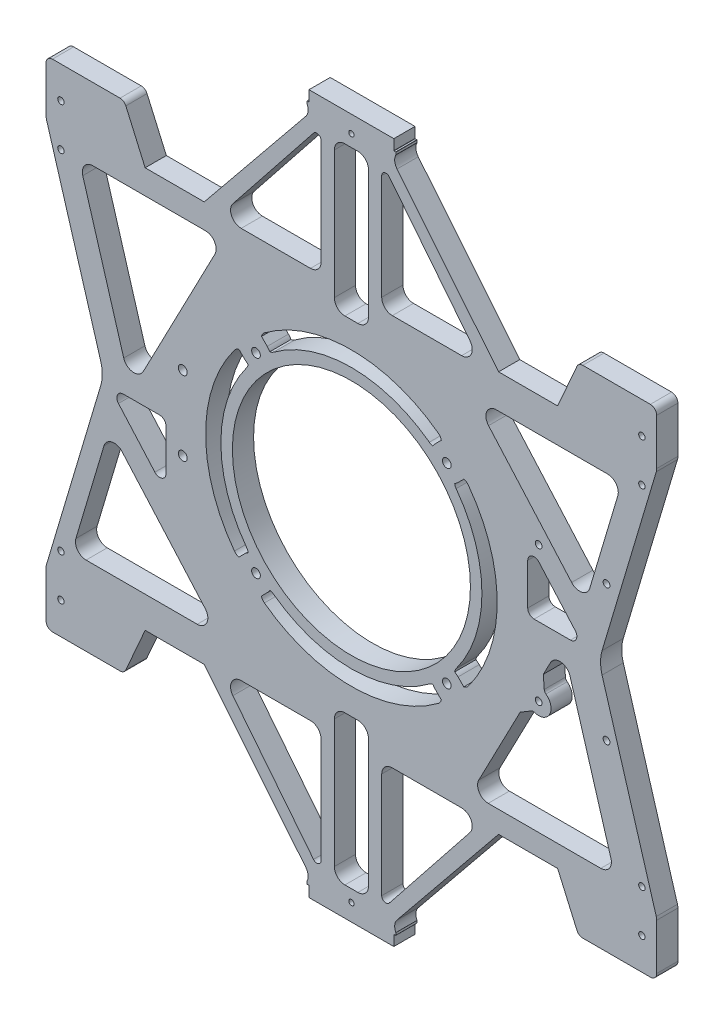
from build123d import *

# Parameters (mm, degrees)
SKETCH_1_R               = 85
SKETCH_1_R_2             = 75
SKETCH_1_R_3             = 7.5
SKETCH_1_R_4             = 2.05
EXTRUDE_1_DEPTH          = 5
EXTRUDE_2_DEPTH          = 5
EXTRUDE_6_DEPTH          = 10
FILLET_2_R               = 0.1
CUT_EXTRUDE_3_DEPTH      = 10
SKETCH_6_W               = 51.301962359
SKETCH_6_H               = 47.017163002
CUT_EXTRUDE_5_DEPTH      = 10
FILLET_3_R               = 3
SKETCH_7_R               = 1.5
CUT_EXTRUDE_6_DEPTH      = 10
MIRROR_2_COPY_1_SKETCH_R = 1.5
MIRROR_2_COPY_1_DEPTH    = 10
SKETCH_8_R               = 1.25
CUT_EXTRUDE_7_DEPTH      = 10
CUT_EXTRUDE_11_DEPTH     = 10
FILLET_6_R               = 5
FILLET_7_R               = 5
SKETCH_16_R              = 2.1
CUT_EXTRUDE_12_DEPTH     = 10
SKETCH_17_R              = 75
SKETCH_17_R_2            = 56.139610307
SKETCH_17_R_3            = 2.05
EXTRUDE_7_DEPTH          = 10
SKETCH_18_R              = 1.6
CUT_EXTRUDE_13_DEPTH     = 10
SKETCH_18_3_R            = 1.6
EXTRUDE_8_DEPTH          = 10
EXTRUDE_9_DEPTH          = 10
FILLET_8_R               = 2


with BuildPart() as part:
    # 草图1 → 凸台-拉伸1 (new, symmetric)
    # profile 1 of 9: a face of its own
    with BuildSketch(Plane.XY):
        Circle(SKETCH_1_R)
        Circle(SKETCH_1_R_2, mode=Mode.SUBTRACT)
    # profile 2 of 9: a face of its own
    with BuildSketch(Plane.XY):
        with BuildLine():
            ThreePointArc((-50.303300859, 39.696699141), (-50.303300859, 50.303300859), (-39.696699141, 50.303300859))
            Line((-39.696699141, 50.303300859), (-47.463876439, 58.070478157))
            ThreePointArc((-47.463876439, 58.070478157), (-53.033008589, 53.033008589), (-58.070478157, 47.463876439))
            Line((-58.070478157, 47.463876439), (-50.303300859, 39.696699141))
        make_face()
    # profile 3 of 9: a face of its own
    with BuildSketch(Plane.XY):
        with Locations((-45, 45)):
            Circle(SKETCH_1_R_3)
        with Locations((-45, 45)):
            Circle(SKETCH_1_R_4, mode=Mode.SUBTRACT)
    # profile 4 of 9: a face of its own
    with BuildSketch(Plane.XY):
        with BuildLine():
            ThreePointArc((58.070478157, 47.463876439), (53.033008589, 53.033008589), (47.463876439, 58.070478157))
            Line((47.463876439, 58.070478157), (39.696699141, 50.303300859))
            ThreePointArc((39.696699141, 50.303300859), (47.870125743, 51.929096494), (52.5, 45))
            ThreePointArc((52.5, 45), (51.929096494, 42.129874257), (50.303300859, 39.696699141))
            Line((50.303300859, 39.696699141), (58.070478157, 47.463876439))
        make_face()
    # profile 5 of 9: a face of its own
    with BuildSketch(Plane.XY):
        with Locations((45, 45)):
            Circle(SKETCH_1_R_3)
        with Locations((45, 45)):
            Circle(SKETCH_1_R_4, mode=Mode.SUBTRACT)
    # profile 6 of 9: a face of its own
    with BuildSketch(Plane.XY):
        with Locations((45, -45)):
            Circle(SKETCH_1_R_3)
        with Locations((45, -45)):
            Circle(SKETCH_1_R_4, mode=Mode.SUBTRACT)
    # profile 7 of 9: a face of its own
    with BuildSketch(Plane.XY):
        with BuildLine():
            ThreePointArc((47.463876439, -58.070478157), (53.033008589, -53.033008589), (58.070478157, -47.463876439))
            Line((58.070478157, -47.463876439), (50.303300859, -39.696699141))
            ThreePointArc((50.303300859, -39.696699141), (51.929096494, -42.129874257), (52.5, -45))
            ThreePointArc((52.5, -45), (47.870125743, -51.929096494), (39.696699141, -50.303300859))
            Line((39.696699141, -50.303300859), (47.463876439, -58.070478157))
        make_face()
    # profile 8 of 9: a face of its own
    with BuildSketch(Plane.XY):
        with Locations((-45, -45)):
            Circle(SKETCH_1_R_3)
        with Locations((-45, -45)):
            Circle(SKETCH_1_R_4, mode=Mode.SUBTRACT)
    # profile 9 of 9: a face of its own
    with BuildSketch(Plane.XY):
        with BuildLine():
            Line((-50.303300859, -39.696699141), (-58.070478157, -47.463876439))
            ThreePointArc((-58.070478157, -47.463876439), (-53.033008589, -53.033008589), (-47.463876439, -58.070478157))
            Line((-47.463876439, -58.070478157), (-39.696699141, -50.303300859))
            ThreePointArc((-39.696699141, -50.303300859), (-50.303300859, -50.303300859), (-50.303300859, -39.696699141))
        make_face()
    extrude(amount=EXTRUDE_1_DEPTH, both=True)

    # 草图2 → 凸台-拉伸2 (add, symmetric)
    with BuildSketch(Plane.XY):
        with BuildLine():
            ThreePointArc((20.946126595, 158.836022137), (20.502012552, 158.586499594), (20, 158.5))
            Line((20, 158.5), (20, 82.613558209))
            ThreePointArc((20, 82.613558209), (66.801946079, 52.559490104), (85, 0))
            ThreePointArc((85, 0), (66.801946079, -52.559490104), (20, -82.613558209))
            Line((20, -82.613558209), (20, -158.5))
            ThreePointArc((20, -158.5), (20.502012552, -158.586499594), (20.946126595, -158.836022137))
            Line((20.946126595, -158.836022137), (72.374524243, -95.565930488))
            ThreePointArc((72.374524243, -95.565930488), (73.413441485, -94.749239274), (74.702479969, -94.458183678))
            Line((74.702479969, -94.458183678), (97.272761921, -94.458183678))
            Line((97.272761921, -94.458183678), (125.278494009, -158.206642183))
            ThreePointArc((125.278494009, -158.206642183), (126.384997835, -159.511964027), (128.025130978, -160))
            Line((128.025130978, -160), (144, -160))
            Line((144, -160), (144, -92.25001583))
            ThreePointArc((144, -92.25001583), (143.947696497, -91.528698023), (143.791880249, -90.822471196))
            Line((143.791880249, -90.822471196), (118.223516251, -4.996406216))
            ThreePointArc((118.223516251, -4.996406216), (117.495097123, 0), (118.223516251, 4.996406216))
            Line((118.223516251, 4.996406216), (143.791880249, 90.822471196))
            ThreePointArc((143.791880249, 90.822471196), (143.947696497, 91.528698023), (144, 92.25001583))
            Line((144, 92.25001583), (144, 160))
            Line((144, 160), (128.025130978, 160))
            ThreePointArc((128.025130978, 160), (126.384997835, 159.511964027), (125.278494009, 158.206642183))
            Line((125.278494009, 158.206642183), (97.272761921, 94.458183678))
            Line((97.272761921, 94.458183678), (74.702479969, 94.458183678))
            ThreePointArc((74.702479969, 94.458183678), (73.413441485, 94.749239274), (72.374524243, 95.565930488))
            Line((72.374524243, 95.565930488), (20.946126595, 158.836022137))
        make_face()
        with BuildLine():
            ThreePointArc((-20, 158.5), (-20.502012552, 158.586499594), (-20.946126595, 158.836022137))
            Line((-20.946126595, 158.836022137), (-72.374524243, 95.565930488))
            ThreePointArc((-72.374524243, 95.565930488), (-73.413441485, 94.749239274), (-74.702479969, 94.458183678))
            Line((-74.702479969, 94.458183678), (-97.272761921, 94.458183678))
            Line((-97.272761921, 94.458183678), (-125.278494009, 158.206642183))
            ThreePointArc((-125.278494009, 158.206642183), (-126.384997835, 159.511964027), (-128.025130978, 160))
            Line((-128.025130978, 160), (-144, 160))
            Line((-144, 160), (-144, 92.25001583))
            ThreePointArc((-144, 92.25001583), (-143.947696497, 91.528698023), (-143.791880249, 90.822471196))
            Line((-143.791880249, 90.822471196), (-118.223516251, 4.996406216))
            ThreePointArc((-118.223516251, 4.996406216), (-117.495097123, 0), (-118.223516251, -4.996406216))
            Line((-118.223516251, -4.996406216), (-143.791880249, -90.822471196))
            ThreePointArc((-143.791880249, -90.822471196), (-143.947696497, -91.528698023), (-144, -92.25001583))
            Line((-144, -92.25001583), (-144, -160))
            Line((-144, -160), (-128.025130978, -160))
            ThreePointArc((-128.025130978, -160), (-126.384997835, -159.511964027), (-125.278494009, -158.206642183))
            Line((-125.278494009, -158.206642183), (-97.272761921, -94.458183678))
            Line((-97.272761921, -94.458183678), (-74.702479969, -94.458183678))
            ThreePointArc((-74.702479969, -94.458183678), (-73.413441485, -94.749239274), (-72.374524243, -95.565930488))
            Line((-72.374524243, -95.565930488), (-20.946126595, -158.836022137))
            ThreePointArc((-20.946126595, -158.836022137), (-20.502012552, -158.586499594), (-20, -158.5))
            Line((-20, -158.5), (-20, -82.613558209))
            ThreePointArc((-20, -82.613558209), (-85, 0), (-20, 82.613558209))
            Line((-20, 82.613558209), (-20, 158.5))
        make_face()
        with BuildLine():
            Line((20, 161.5), (20, 165))
            Line((20, 165), (-20, 165))
            Line((-20, 165), (-20, 161.5))
            ThreePointArc((-20, 161.5), (-18.939339828, 161.060660172), (-18.5, 160))
            ThreePointArc((-18.5, 160), (-18.939339828, 158.939339828), (-20, 158.5))
            Line((-20, 158.5), (-20, 82.613558209))
            ThreePointArc((-20, 82.613558209), (0, 85), (20, 82.613558209))
            Line((20, 82.613558209), (20, 158.5))
            ThreePointArc((20, 158.5), (18.5, 160), (20, 161.5))
        make_face()
        with BuildLine():
            Line((20, -158.5), (20, -82.613558209))
            ThreePointArc((20, -82.613558209), (0, -85), (-20, -82.613558209))
            Line((-20, -82.613558209), (-20, -158.5))
            ThreePointArc((-20, -158.5), (-18.939339828, -158.939339828), (-18.5, -160))
            ThreePointArc((-18.5, -160), (-18.939339828, -161.060660172), (-20, -161.5))
            Line((-20, -161.5), (-20, -165))
            Line((-20, -165), (20, -165))
            Line((20, -165), (20, -161.5))
            ThreePointArc((20, -161.5), (18.5, -160), (20, -158.5))
        make_face()
    extrude(amount=EXTRUDE_2_DEPTH, both=True)

    # 草图4 → 凸台-拉伸6 (add)
    with BuildSketch(Plane(origin=(0, 0, -5), x_dir=(-1, 0, 0), z_dir=(0, 0, -1))):
        Polygon((0, 165), (-20, 165), (-20, 160), (-20.946126595, 160), (-20.946126595, 158.836022137), (0, 158.836022137), align=None)
        Polygon((20, 165), (0, 165), (0, 158.836022137), (20.946126595, 158.836022137), (20.946126595, 160), (20, 160), align=None)
        Polygon((0, 157.92755691), (0, 158.836022137), (-20.946126595, 158.836022137), (-20.162822672, 157.92755691), align=None)
        Polygon((20.946126595, 158.836022137), (0, 158.836022137), (0, 157.92755691), (20.162822672, 157.92755691), align=None)
        Polygon((-20.946126595, -158.836022137), (-20.162822672, -157.92755691), (20.162822672, -157.92755691), (20.946126595, -158.836022137), align=None)
        Polygon((-20, -165), (-20, -160), (-20.946126595, -160), (-20.946126595, -158.836022137), (20.946126595, -158.836022137), (20.946126595, -160), (20, -160), (20, -165), align=None)
    extrude(amount=-EXTRUDE_6_DEPTH)

    # 圆角2
    fillet_2_edges = [part.edges().sort_by_distance(p)[0] for p in [
        (20.946126595, 160, 0),
        (20, 160, 0),
        (-20, 160, 0),
        (-20.946126595, 160, 0),
        (-20.946126595, -160, 0),
        (-20, -160, 0),
        (20, -160, 0),
        (20.946126595, -160, 0),
        (144, -160, 0),
        (144, 160, 0),
        (20.946126595, 158.836022137, 0),
        (-20.946126595, 158.836022137, 0),
        (-144, 160, 0),
        (-144, -160, 0),
        (-20.946126595, -158.836022137, 0),
        (20.946126595, -158.836022137, 0),
    ]]
    fillet(fillet_2_edges, radius=FILLET_2_R)

    # 草图5 → 切除-拉伸3 (cut)
    with BuildSketch(Plane(origin=(0, 0, -5), x_dir=(-1, 0, 0), z_dir=(0, 0, -1))):
        with BuildLine():
            Line((-17.862789417, 148.320403404), (-55.905502661, 100.478809476))
            ThreePointArc((-55.905502661, 100.478809476), (-56.495296771, 95.194269743), (-51.991975369, 92.366848015))
            Line((-51.991975369, 92.366848015), (-19.297378501, 92.366848015))
            ThreePointArc((-19.297378501, 92.366848015), (-15.761844595, 93.831314109), (-14.297378501, 97.366848015))
            Line((-14.297378501, 97.366848015), (-14.297378501, 147.075618819))
            ThreePointArc((-14.297378501, 147.075618819), (-15.638144791, 148.963848391), (-17.862789417, 148.320403404))
        make_face()
        with BuildLine():
            Line((-3.055863592, 151.352836998), (3.055863592, 151.352836998))
            ThreePointArc((3.055863592, 151.352836998), (6.591397498, 149.888370904), (8.055863592, 146.352836998))
            Line((8.055863592, 146.352836998), (8.055863592, 86.048360151))
            ThreePointArc((8.055863592, 86.048360151), (6.591397498, 82.512826245), (3.055863592, 81.048360151))
            Line((3.055863592, 81.048360151), (-3.055863592, 81.048360151))
            ThreePointArc((-3.055863592, 81.048360151), (-6.591397498, 82.512826245), (-8.055863592, 86.048360151))
            Line((-8.055863592, 86.048360151), (-8.055863592, 146.352836998))
            ThreePointArc((-8.055863592, 146.352836998), (-6.591397498, 149.888370904), (-3.055863592, 151.352836998))
        make_face()
        with BuildLine():
            Line((17.862789417, 148.320403404), (55.905502661, 100.478809476))
            ThreePointArc((55.905502661, 100.478809476), (56.495296771, 95.194269743), (51.991975369, 92.366848015))
            Line((51.991975369, 92.366848015), (19.297378501, 92.366848015))
            ThreePointArc((19.297378501, 92.366848015), (15.761844595, 93.831314109), (14.297378501, 97.366848015))
            Line((14.297378501, 97.366848015), (14.297378501, 147.075618819))
            ThreePointArc((14.297378501, 147.075618819), (15.638144791, 148.963848391), (17.862789417, 148.320403404))
        make_face()
        with BuildLine():
            Line((-88.411964724, 26.304592471), (-105.58420797, 6.825549304))
            ThreePointArc((-105.58420797, 6.825549304), (-106.068021221, 3.60709215), (-103.33382643, 1.841668531))
            Line((-103.33382643, 1.841668531), (-86.161583184, 1.841668531))
            ThreePointArc((-86.161583184, 1.841668531), (-84.04026284, 2.720348187), (-83.161583184, 4.841668531))
            Line((-83.161583184, 4.841668531), (-83.161583184, 24.320711698))
            ThreePointArc((-83.161583184, 24.320711698), (-85.101192836, 27.127056707), (-88.411964724, 26.304592471))
        make_face()
        with BuildLine():
            Line((125.148737545, -79.703150581), (72.714799918, -79.703150581))
            ThreePointArc((72.714799918, -79.703150581), (68.157808598, -76.760777882), (68.964164017, -71.396682626))
            Line((68.964164017, -71.396682626), (108.154563697, -26.941716773))
            ThreePointArc((108.154563697, -26.941716773), (112.979273925, -25.364910792), (116.697079847, -28.820640095))
            Line((116.697079847, -28.820640095), (129.940617794, -73.275605947))
            ThreePointArc((129.940617794, -73.275605947), (129.157336001, -77.691651612), (125.148737545, -79.703150581))
        make_face()
        with BuildLine():
            Line((92.688824268, -27.57870776), (109.861067514, -8.099664592))
            ThreePointArc((109.861067514, -8.099664592), (110.344880765, -4.881207439), (107.610685973, -3.11578382))
            Line((107.610685973, -3.11578382), (90.438442727, -3.11578382))
            ThreePointArc((90.438442727, -3.11578382), (88.317122384, -3.994463476), (87.438442727, -6.11578382))
            Line((87.438442727, -6.11578382), (87.438442727, -25.594826987))
            ThreePointArc((87.438442727, -25.594826987), (89.37805238, -28.401171996), (92.688824268, -27.57870776))
        make_face()
        with BuildLine():
            Line((64.354570863, 75.652229573), (98.156817983, 10.809427785))
            ThreePointArc((98.156817983, 10.809427785), (103.067325793, 8.143494388), (107.382429225, 11.693166232))
            Line((107.382429225, 11.693166232), (126.699688605, 76.535968021))
            ThreePointArc((126.699688605, 76.535968021), (125.916406812, 80.952013686), (121.907808356, 82.963512654))
            Line((121.907808356, 82.963512654), (68.788301856, 82.963512654))
            ThreePointArc((68.788301856, 82.963512654), (64.512999797, 80.556154607), (64.354570863, 75.652229573))
        make_face()
        with BuildLine():
            Line((14.297378501, -147.075618819), (14.297378501, -97.366848015))
            ThreePointArc((14.297378501, -97.366848015), (15.761844595, -93.831314109), (19.297378501, -92.366848015))
            Line((19.297378501, -92.366848015), (51.991975369, -92.366848015))
            ThreePointArc((51.991975369, -92.366848015), (56.495296771, -95.194269743), (55.905502661, -100.478809476))
            Line((55.905502661, -100.478809476), (17.862789417, -148.320403404))
            ThreePointArc((17.862789417, -148.320403404), (15.638144791, -148.963848391), (14.297378501, -147.075618819))
        make_face()
        with BuildLine():
            Line((-3.055863592, -81.048360151), (3.055863592, -81.048360151))
            ThreePointArc((3.055863592, -81.048360151), (6.591397498, -82.512826245), (8.055863592, -86.048360151))
            Line((8.055863592, -86.048360151), (8.055863592, -146.352836998))
            ThreePointArc((8.055863592, -146.352836998), (6.591397498, -149.888370904), (3.055863592, -151.352836998))
            Line((3.055863592, -151.352836998), (-3.055863592, -151.352836998))
            ThreePointArc((-3.055863592, -151.352836998), (-6.591397498, -149.888370904), (-8.055863592, -146.352836998))
            Line((-8.055863592, -146.352836998), (-8.055863592, -86.048360151))
            ThreePointArc((-8.055863592, -86.048360151), (-6.591397498, -82.512826245), (-3.055863592, -81.048360151))
        make_face()
        with BuildLine():
            Line((-17.862789417, -148.320403404), (-55.905502661, -100.478809476))
            ThreePointArc((-55.905502661, -100.478809476), (-56.495296771, -95.194269743), (-51.991975369, -92.366848015))
            Line((-51.991975369, -92.366848015), (-19.297378501, -92.366848015))
            ThreePointArc((-19.297378501, -92.366848015), (-15.761844595, -93.831314109), (-14.297378501, -97.366848015))
            Line((-14.297378501, -97.366848015), (-14.297378501, -147.075618819))
            ThreePointArc((-14.297378501, -147.075618819), (-15.638144791, -148.963848391), (-17.862789417, -148.320403404))
        make_face()
        with BuildLine():
            Line((-125.66375825, 72.001490659), (-112.420220303, 27.546524806))
            ThreePointArc((-112.420220303, 27.546524806), (-108.702414381, 24.090795503), (-103.877704153, 25.667601485))
            Line((-103.877704153, 25.667601485), (-64.687304473, 70.122567337))
            ThreePointArc((-64.687304473, 70.122567337), (-63.880949055, 75.486662593), (-68.437940375, 78.429035292))
            Line((-68.437940375, 78.429035292), (-120.871878001, 78.429035292))
            ThreePointArc((-120.871878001, 78.429035292), (-124.880476458, 76.417536323), (-125.66375825, 72.001490659))
        make_face()
        with BuildLine():
            Line((-103.105569682, -12.967281521), (-122.422829061, -77.81008331))
            ThreePointArc((-122.422829061, -77.81008331), (-121.639547269, -82.226128975), (-117.630948812, -84.237627943))
            Line((-117.630948812, -84.237627943), (-64.511442313, -84.237627943))
            ThreePointArc((-64.511442313, -84.237627943), (-60.236140253, -81.830269896), (-60.07771132, -76.926344862))
            Line((-60.07771132, -76.926344862), (-93.87995844, -12.083543073))
            ThreePointArc((-93.87995844, -12.083543073), (-98.79046625, -9.417609677), (-103.105569682, -12.967281521))
        make_face()
    extrude(amount=-CUT_EXTRUDE_3_DEPTH, mode=Mode.SUBTRACT)

    # 草图6 → 切除-拉伸5 (cut)
    with BuildSketch(Plane(origin=(0, 0, -5), x_dir=(-1, 0, 0), z_dir=(0, 0, -1))):
        with Locations((-118.34901882, 140.494508807)):
            Rectangle(SKETCH_6_W, SKETCH_6_H)
        Polygon((88.757366103, 116.985927306), (144, 116.985927306), (159.693978527, 195.891540768), (92.954798791, 181.200526361), align=None)
        Polygon((-111.178516053, -202.298889523), (-78.959246023, -116.985927306), (-144, -116.985927306), (-230.528890872, -157.225059538), align=None)
        Polygon((155.497903579, -186.437095046), (144, -116.985927306), (88.757366103, -116.985927306), (58.840093489, -186.437095046), align=None)
    extrude(amount=-CUT_EXTRUDE_5_DEPTH, mode=Mode.SUBTRACT)

    # 圆角3
    fillet_3_edges = [part.edges().sort_by_distance(p)[0] for p in [
        (107.169565191, -116.985927306, 0),
        (-107.169565191, -116.985927306, 0),
        (107.169565191, 116.985927306, 0),
        (-144, 116.985927306, 0),
        (-107.169565191, 116.985927306, 0),
        (144, -116.985927306, 0),
        (-144, -116.985927306, 0),
        (144, 116.985927306, 0),
    ]]
    fillet(fillet_3_edges, radius=FILLET_3_R)

    # 草图7 → 切除-拉伸6 (cut)
    with BuildSketch(Plane(origin=(0, 0, -5), x_dir=(-1, 0, 0), z_dir=(0, 0, -1))):
        with Locations((-137, 101.985927306)):
            Circle(SKETCH_7_R)
        with Locations((-137, 81.985927306)):
            Circle(SKETCH_7_R)
    cut_extrude_6 = extrude(amount=-CUT_EXTRUDE_6_DEPTH, mode=Mode.SUBTRACT)

    # 镜向1: 切除-拉伸6 across plane
    add(cut_extrude_6.mirror(Plane(origin=(0, 0, 0), x_dir=(0, 0, 1), z_dir=(1, 0, 0))), mode=Mode.SUBTRACT)

    # 镜向2: 切除-拉伸6 across plane
    add(cut_extrude_6.mirror(Plane.ZX), mode=Mode.SUBTRACT)

    # 镜向2 copy 1 sketch → 镜向2 copy 1 (cut)
    with BuildSketch(Plane(origin=(0, 0, -5), x_dir=(1, 0, 0), z_dir=(0, 0, -1))):
        with Locations((-137, 101.985927306)):
            Circle(MIRROR_2_COPY_1_SKETCH_R)
        with Locations((-137, 81.985927306)):
            Circle(MIRROR_2_COPY_1_SKETCH_R)
    extrude(amount=-MIRROR_2_COPY_1_DEPTH, mode=Mode.SUBTRACT)

    # 草图8 → 切除-拉伸7 (cut)
    with BuildSketch(Plane(origin=(0, 0, -5), x_dir=(-1, 0, 0), z_dir=(0, 0, -1))):
        with Locations((0, 157)):
            Circle(SKETCH_8_R)
    cut_extrude_7 = extrude(amount=-CUT_EXTRUDE_7_DEPTH, mode=Mode.SUBTRACT)

    # 镜向3: 切除-拉伸7 across plane
    add(cut_extrude_7.mirror(Plane.ZX), mode=Mode.SUBTRACT)

    # 草图14 → 切除-拉伸11 (cut)
    with BuildSketch(Plane(origin=(0, 0, -5), x_dir=(-1, 0, 0), z_dir=(0, 0, -1))):
        Polygon((-74.702479969, 94.458183678), (-69.40889114, 94.458183678), (-17.102475165, 158.808462588), (-20.968528071, 158.808462588), align=None)
        Polygon((74.702479969, 94.458183678), (69.40889114, 94.458183678), (17.102475165, 158.808462588), (20.968528071, 158.808462588), align=None)
        Polygon((74.702479969, -94.458183678), (20.968528071, -158.808462588), (17.102475165, -158.808462588), (69.40889114, -94.458183678), align=None)
        Polygon((-74.702479969, -94.458183678), (-69.40889114, -94.458183678), (-17.102475165, -158.808462588), (-20.968528071, -158.808462588), align=None)
    extrude(amount=-CUT_EXTRUDE_11_DEPTH, mode=Mode.SUBTRACT)

    # 圆角6
    # the kernel refuses this fillet: 5 mm, written as the material it adds along each edge
    with BuildSketch(Plane(origin=(-17.102475165, 158.808462588, -5), x_dir=(-0.6307510635211512, -0.7759852420419713, 0), z_dir=(0, 0, 1))) as fillet_6_piece_1:
        with BuildLine():
            CenterArc((7.021092677, -5), FILLET_6_R, 90, 66.421821522)
            Line((2.438516982, -3), (2.346865468, -2.96))
            ThreePointArc((2.346865468, -2.96), (1.141659967, -1.563075106), (-0.077598524, -0.063075106))
            Line((-0.077598524, -0.063075106), (0, 0.1))
            Line((0, 0.1), (7.021092677, 0.1))
            Line((7.021092677, 0.1), (7.021092677, 0))
        make_face()
    extrude(amount=10)
    with BuildSketch(Plane(origin=(17.102475165, 158.808462588, -5), x_dir=(1, 0, 0), z_dir=(0, 0, 1))) as fillet_6_piece_2:
        with BuildLine():
            CenterArc((8.308487883, -2.294508983), FILLET_6_R, 152.683734881, 66.421821522)
            Line((4.428561673, -5.4482643), (4.350963149, -5.511339407))
            Line((4.350963149, -5.511339407), (-0.077598524, -0.063075106))
            Line((-0.077598524, -0.063075106), (0, 0.1))
            ThreePointArc((0, 0.1), (1.933026453, 0.1), (3.777204206, 0.04589018))
            Line((3.777204206, 0.04589018), (3.866052906, 0))
        make_face()
    extrude(amount=10)

    # 圆角7
    # the kernel refuses this fillet: 5 mm, written as the material it adds along each edge
    with BuildSketch(Plane(origin=(-17.102475165, -158.808462588, -5), x_dir=(-0.630751063521152, 0.7759852420419706, 0), z_dir=(0, 0, 1))) as fillet_7_piece_1:
        with BuildLine():
            CenterArc((7.021092677, 5), FILLET_7_R, 203.578178478, 66.421821522)
            Line((2.438516982, 3), (2.346865468, 2.96))
            ThreePointArc((2.346865468, 2.96), (1.141659967, 1.563075106), (-0.077598524, 0.063075106))
            Line((-0.077598524, 0.063075106), (0, -0.1))
            Line((0, -0.1), (7.021092677, -0.1))
            Line((7.021092677, -0.1), (7.021092677, 0))
        make_face()
    extrude(amount=10)
    with BuildSketch(Plane(origin=(17.102475165, -158.808462588, -5), x_dir=(1, 0, 0), z_dir=(0, 0, 1))) as fillet_7_piece_2:
        with BuildLine():
            CenterArc((8.308487883, 2.294508983), FILLET_7_R, 140.894443597, 66.421821522)
            Line((4.428561673, 5.4482643), (4.350963149, 5.511339407))
            Line((4.350963149, 5.511339407), (-0.077598524, 0.063075106))
            Line((-0.077598524, 0.063075106), (0, -0.1))
            ThreePointArc((0, -0.1), (1.933026453, -0.1), (3.777204206, -0.04589018))
            Line((3.777204206, -0.04589018), (3.866052906, 0))
        make_face()
    extrude(amount=10)

    # 草图16 → 切除-拉伸12 (cut)
    with BuildSketch(Plane(origin=(0, 0, -5), x_dir=(-1, 0, 0), z_dir=(0, 0, -1))):
        with Locations((79.532362142, 20.695093854)):
            Circle(SKETCH_16_R)
        with Locations((79.532362142, -14.304906146)):
            Circle(SKETCH_16_R)
    extrude(amount=-CUT_EXTRUDE_12_DEPTH, mode=Mode.SUBTRACT)

    # 草图17 → 凸台-拉伸7 (add)
    with BuildSketch(Plane(origin=(0, 0, -5), x_dir=(-1, 0, 0), z_dir=(0, 0, -1))):
        Circle(SKETCH_17_R)
        Circle(SKETCH_17_R_2, mode=Mode.SUBTRACT)
        with Locations(Location((45, -45, 0), (0, 0, 180))):
            Circle(SKETCH_17_R_3, mode=Mode.SUBTRACT)
        with Locations(Location((-45, -45, 0), (0, 0, 180))):
            Circle(SKETCH_17_R_3, mode=Mode.SUBTRACT)
        with Locations(Location((45, 45, 0), (0, 0, 180))):
            Circle(SKETCH_17_R_3, mode=Mode.SUBTRACT)
        with Locations(Location((-45, 45, 0), (0, 0, 180))):
            Circle(SKETCH_17_R_3, mode=Mode.SUBTRACT)
        with BuildLine():
            ThreePointArc((41.044132082, 55.163882669), (0, 68.758088466), (-41.044132082, 55.163882669))
            ThreePointArc((-41.044132082, 55.163882669), (-41.782353975, 50.133846032), (-36.752317339, 49.39562414))
            ThreePointArc((-36.752317339, 49.39562414), (0, 61.568340191), (36.752317339, 49.39562414))
            ThreePointArc((36.752317339, 49.39562414), (41.782353975, 50.133846032), (41.044132082, 55.163882669))
        make_face(mode=Mode.SUBTRACT)
        with BuildLine():
            ThreePointArc((49.39562414, -36.752317339), (61.568340191, 0), (49.39562414, 36.752317339))
            ThreePointArc((49.39562414, 36.752317339), (50.133846032, 41.782353975), (55.163882669, 41.044132082))
            ThreePointArc((55.163882669, 41.044132082), (68.758088466, 0), (55.163882669, -41.044132082))
            ThreePointArc((55.163882669, -41.044132082), (50.133846032, -41.782353975), (49.39562414, -36.752317339))
        make_face(mode=Mode.SUBTRACT)
        with BuildLine():
            ThreePointArc((-36.752317339, -49.39562414), (0, -61.568340191), (36.752317339, -49.39562414))
            ThreePointArc((36.752317339, -49.39562414), (41.782353975, -50.133846032), (41.044132082, -55.163882669))
            ThreePointArc((41.044132082, -55.163882669), (0, -68.758088466), (-41.044132082, -55.163882669))
            ThreePointArc((-41.044132082, -55.163882669), (-41.782353975, -50.133846032), (-36.752317339, -49.39562414))
        make_face(mode=Mode.SUBTRACT)
        with BuildLine():
            ThreePointArc((-49.39562414, 36.752317339), (-61.568340191, 0), (-49.39562414, -36.752317339))
            ThreePointArc((-49.39562414, -36.752317339), (-50.133846032, -41.782353975), (-55.163882669, -41.044132082))
            ThreePointArc((-55.163882669, -41.044132082), (-68.758088466, 0), (-55.163882669, 41.044132082))
            ThreePointArc((-55.163882669, 41.044132082), (-50.133846032, 41.782353975), (-49.39562414, 36.752317339))
        make_face(mode=Mode.SUBTRACT)
    extrude(amount=-EXTRUDE_7_DEPTH)

    # 草图18 → 切除-拉伸13 (cut)
    with BuildSketch(Plane(origin=(0, 0, -5), x_dir=(-1, 0, 0), z_dir=(0, 0, -1))):
        with Locations((-120.321272301, 33.315903929)):
            Circle(SKETCH_18_R)
        with Locations((-88.321272301, 33.315903929)):
            Circle(SKETCH_18_R)
        with Locations((-120.321272301, -30.684096071)):
            Circle(SKETCH_18_R)
    extrude(amount=-CUT_EXTRUDE_13_DEPTH, mode=Mode.SUBTRACT)

    # 草图18<3> → 凸台-拉伸8 (add)
    with BuildSketch(Plane(origin=(0, 0, -5), x_dir=(-1, 0, 0), z_dir=(0, 0, -1))):
        with BuildLine():
            ThreePointArc((-82.486293869, -30.684096071), (-92.447225118, -26.558143254), (-88.321272301, -36.519074503))
            ThreePointArc((-88.321272301, -36.519074503), (-86.931254875, -36.351090411), (-85.621272301, -35.856810378))
            Line((-85.621272301, -35.856810378), (-85.621272301, -35.684096071))
            Line((-85.621272301, -35.684096071), (-85.313453606, -35.684096071))
            ThreePointArc((-85.313453606, -35.684096071), (-83.242023808, -33.556065438), (-82.486293869, -30.684096071))
        make_face()
        with Locations((-88.321272301, -30.684096071)):
            Circle(SKETCH_18_3_R, mode=Mode.SUBTRACT)
    extrude(amount=-EXTRUDE_8_DEPTH)

    # 草图19 → 凸台-拉伸9 (add)
    with BuildSketch(Plane(origin=(0, 0, -5), x_dir=(-1, 0, 0), z_dir=(0, 0, -1))):
        Polygon((-90.522481675, -18.524185897), (-91.018529686, -25.509951127), (-85.067725227, -28.988037308), align=None)
        Polygon((-79.612968778, -39.451888718), (-85.067725227, -28.988037308), (-85.624014915, -35.858241014), align=None)
    extrude(amount=-EXTRUDE_9_DEPTH)

    # 圆角8
    fillet_8_edges = [part.edges().sort_by_distance(p)[0] for p in [
        (91.018529686, -25.509951127, 0),
        (85.624014915, -35.858241014, 0),
    ]]
    fillet(fillet_8_edges, radius=FILLET_8_R)


solid = part.part
